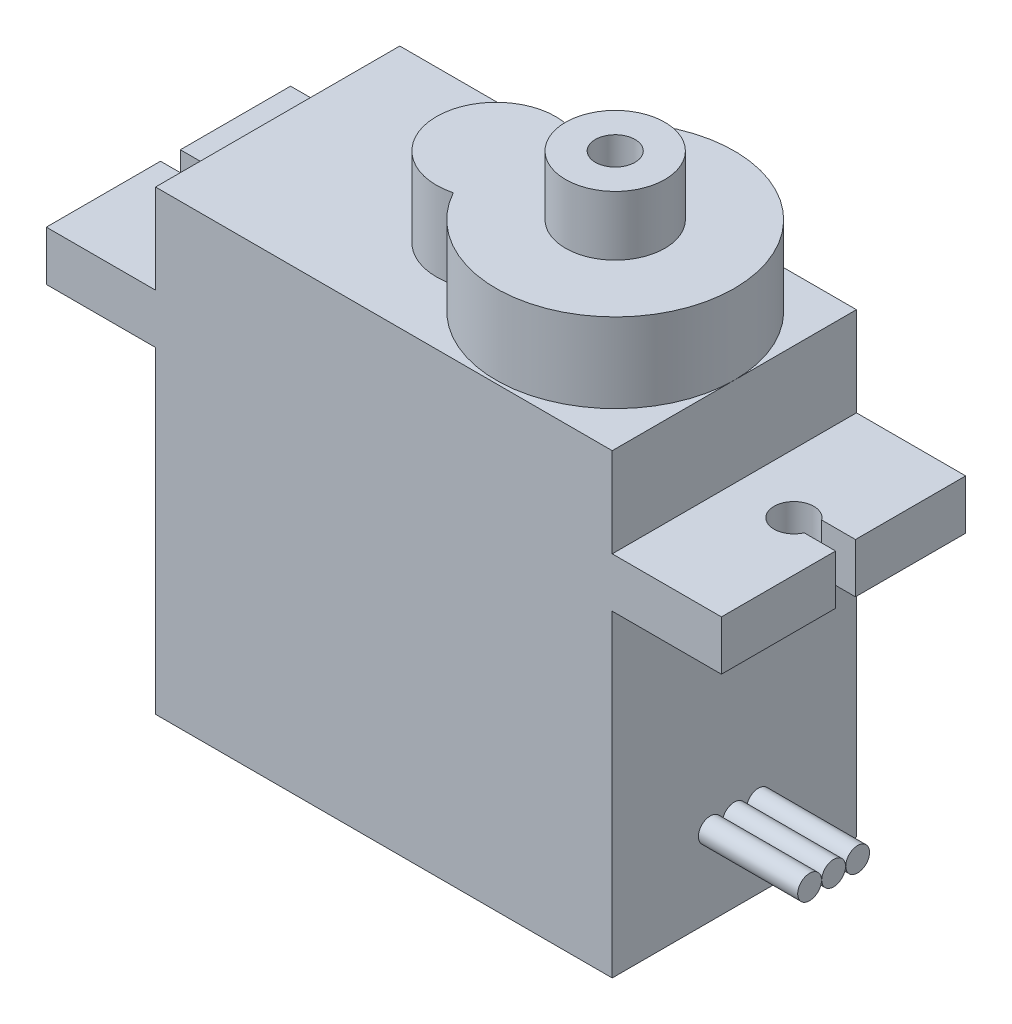
from build123d import *

# Parameters (mm, degrees)
SKETCH1_W           = 23
SKETCH1_H           = 12.3
BOSS_EXTRUDE1_DEPTH = 23
SKETCH2_W           = 12.3
SKETCH2_H           = 2.5
BOSS_EXTRUDE2_DEPTH = 5.5
CUT_EXTRUDE1_DEPTH  = 5
BOSS_EXTRUDE3_DEPTH = 4
SKETCH5_R           = 2.5
SKETCH5_R_2         = 1
BOSS_EXTRUDE4_DEPTH = 3
SKETCH7_R           = 0.6
BOSS_EXTRUDE8_DEPTH = 5


with BuildPart() as part:
    # Sketch1 → Boss-Extrude1 (new body)
    with BuildSketch(Plane(origin=(0, 0, 0), x_dir=(1, 0, 0), z_dir=(0, 1, 0))):
        Rectangle(SKETCH1_W, SKETCH1_H)
    extrude(amount=BOSS_EXTRUDE1_DEPTH)

    # Sketch2 → Boss-Extrude2 (add)
    with BuildSketch(Plane.ZY.offset(11.5)):
        with Locations((0, 17.25)):
            Rectangle(SKETCH2_W, SKETCH2_H)
    boss_extrude2 = extrude(amount=BOSS_EXTRUDE2_DEPTH)

    # Sketch3 → Cut-Extrude1 (cut)
    with BuildSketch(Plane(origin=(0, 18.5, 0), x_dir=(1, 0, 0), z_dir=(0, 1, 0))):
        with BuildLine():
            Line((-17, 0.6), (-15.3, 0.6))
            ThreePointArc((-15.3, 0.6), (-13.506719548, -0.11573221), (-15.416515139, -0.4))
            Line((-15.416515139, -0.4), (-17, -0.4))
            Line((-17, -0.4), (-17, 0.6))
        make_face()
    cut_extrude1 = extrude(amount=-CUT_EXTRUDE1_DEPTH, mode=Mode.SUBTRACT)

    # Mirror1: Boss-Extrude2, Cut-Extrude1 across plane
    add(boss_extrude2.mirror(Plane(origin=(0, 0, 0), x_dir=(0, 0, 1), z_dir=(1, 0, 0))))
    add(cut_extrude1.mirror(Plane(origin=(0, 0, 0), x_dir=(0, 0, 1), z_dir=(1, 0, 0))), mode=Mode.SUBTRACT)

    # Sketch4 → Boss-Extrude3 (add)
    with BuildSketch(Plane(origin=(0, 23, 0), x_dir=(1, 0, 0), z_dir=(0, 1, 0))):
        with BuildLine():
            ThreePointArc((0.25, -2.90473751), (11.5, 0), (0.25, 2.90473751))
            ThreePointArc((0.25, 2.90473751), (-3.5, 0), (0.25, -2.90473751))
        make_face()
    extrude(amount=BOSS_EXTRUDE3_DEPTH)

    # Sketch5 → Boss-Extrude4 (add)
    with BuildSketch(Plane(origin=(0, 27, 0), x_dir=(1, 0, 0), z_dir=(0, 1, 0))):
        with Locations((5.5, 0)):
            Circle(SKETCH5_R)
        with Locations((5.5, 0)):
            Circle(SKETCH5_R_2, mode=Mode.SUBTRACT)
    extrude(amount=BOSS_EXTRUDE4_DEPTH)

    # Sketch7 → Boss-Extrude8 (add)
    with BuildSketch(Plane(origin=(11.5, 0, 0), x_dir=(0, 0, -1), z_dir=(1, 0, 0))):
        with Locations((0, 4)):
            Circle(SKETCH7_R)
        with Locations((1.21, 4)):
            Circle(SKETCH7_R)
        with Locations((-1.21, 4)):
            Circle(SKETCH7_R)
    extrude(amount=BOSS_EXTRUDE8_DEPTH)


solid = part.part
